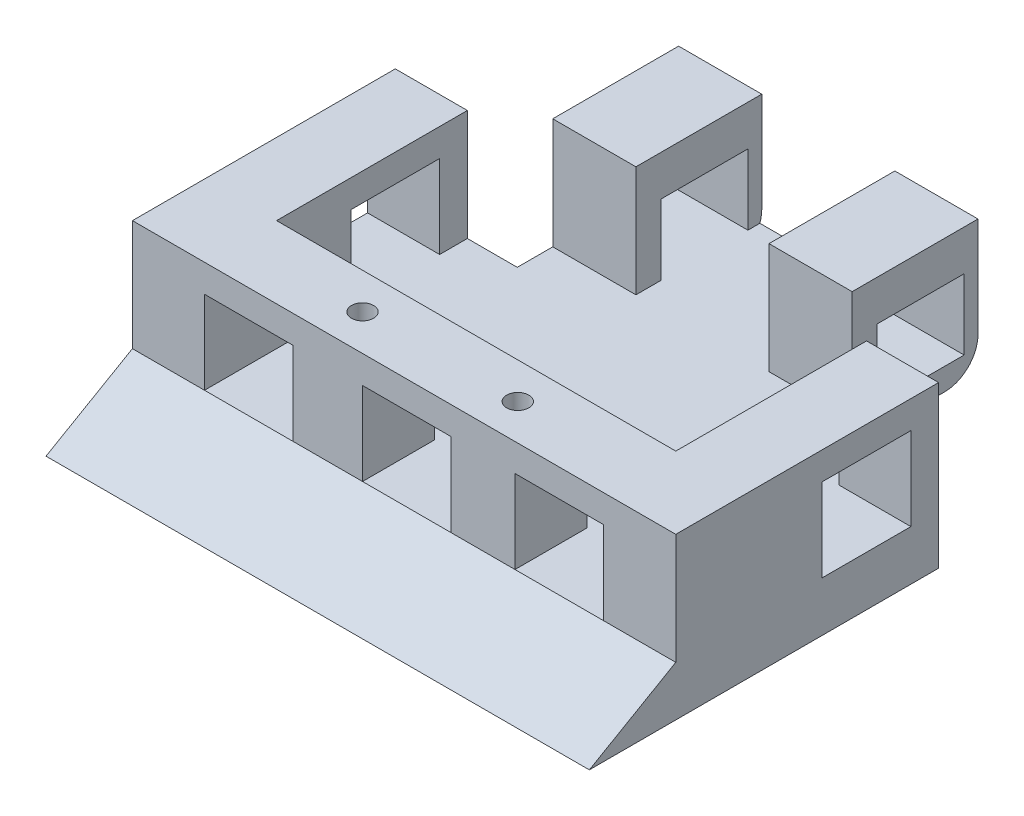
from build123d import *

# Parameters (mm, degrees)
CROQUIS1_W              = 98
CROQUIS1_H              = 98
SALIENTE_EXTRUIR1_DEPTH = 9
CHAFL_N1_SIZE2          = 15.588457268
CHAFL_N1_SIZE           = 9
CROQUIS2_W              = 22
CROQUIS2_H              = 35
CORTAR_EXTRUIR1_DEPTH   = 9
CROQUIS3_W              = 15
CROQUIS3_H              = 2.5
SALIENTE_EXTRUIR2_DEPTH = 12.2
CROQUIS4_W              = 15
CROQUIS4_H              = 20.2
SALIENTE_EXTRUIR3_DEPTH = 2.5
CROQUIS5_W              = 5.9
CROQUIS5_H              = 9
CORTAR_EXTRUIR2_DEPTH   = 54.2
CROQUIS6_W              = 15
CROQUIS6_H              = 14.7
SALIENTE_EXTRUIR4_DEPTH = 2.5
SALIENTE_EXTRUIR5_DEPTH = 20
CROQUIS8_W              = 16
CROQUIS8_H              = 15
CORTAR_EXTRUIR3_DEPTH   = 98
CROQUIS9_W              = 16
CROQUIS9_H              = 15
CORTAR_EXTRUIR4_DEPTH   = 13
CROQUIS10_W             = 15
CROQUIS10_H             = 22.7
SALIENTE_EXTRUIR6_DEPTH = 5.3
CROQUIS11_R             = 2
CORTAR_EXTRUIR5_DEPTH   = 10
CROQUIS12_W             = 29.1
CROQUIS12_H             = 5
CORTAR_EXTRUIR6_DEPTH   = 95.963150748
NERVIO1_REACH           = 77.12
CROQUIS13_WALL_W        = 159.310876118
CROQUIS13_WALL_H        = 54
REDONDEO1_R             = 6
CROQUIS14_W             = 15.7
CROQUIS14_H             = 12.7
CORTAR_EXTRUIR7_DEPTH   = 95.963150748


# Some blends are built 0.0001 mm under size
with BuildPart() as part:
    # Croquis1 → Saliente-Extruir1 (new body)
    with BuildSketch(Plane(origin=(0, 0, 0), x_dir=(1, 0, 0), z_dir=(0, 1, 0))):
        Rectangle(CROQUIS1_W, CROQUIS1_H)
    extrude(amount=SALIENTE_EXTRUIR1_DEPTH)

    # Chaflán1
    chafl_n1_edges = [part.edges().sort_by_distance(p)[0] for p in [
        (0, 9, 49),
    ]]
    chafl_n1_side = [part.faces().sort_by_distance(p)[0] for p in [
        (0, 8.82, 49),
    ]]
    chamfer(chafl_n1_edges, length=CHAFL_N1_SIZE - 0.0001, length2=CHAFL_N1_SIZE2 - 0.0001, reference=chafl_n1_side[0])  # a hair under: the kernel refuses the full size

    # Croquis2 → Cortar-Extruir1 (cut)
    with BuildSketch(Plane(origin=(0, 9, 0), x_dir=(1, 0, 0), z_dir=(0, 1, 0))):
        with Locations((-38, 31.5)):
            Rectangle(CROQUIS2_W, CROQUIS2_H)
        with Locations((38, 31.5)):
            Rectangle(CROQUIS2_W, CROQUIS2_H)
    extrude(amount=-CORTAR_EXTRUIR1_DEPTH, mode=Mode.SUBTRACT)

    # Croquis3 → Saliente-Extruir2 (add)
    with BuildSketch(Plane(origin=(0, 9, 0), x_dir=(1, 0, 0), z_dir=(0, 1, 0))):
        with Locations((19.5, 41.85)):
            Rectangle(CROQUIS3_W, CROQUIS3_H)
        with Locations((19.5, 24.15)):
            Rectangle(CROQUIS3_W, CROQUIS3_H)
        with Locations((-19.5, 41.85)):
            Rectangle(CROQUIS3_W, CROQUIS3_H)
        with Locations((-19.5, 24.15)):
            Rectangle(CROQUIS3_W, CROQUIS3_H)
    extrude(amount=SALIENTE_EXTRUIR2_DEPTH)

    # Croquis4 → Saliente-Extruir3 (add)
    with BuildSketch(Plane(origin=(0, 21.2, 0), x_dir=(1, 0, 0), z_dir=(0, 1, 0))):
        with Locations((-19.5, 33)):
            Rectangle(CROQUIS4_W, CROQUIS4_H)
        with Locations((19.5, 33)):
            Rectangle(CROQUIS4_W, CROQUIS4_H)
    extrude(amount=SALIENTE_EXTRUIR3_DEPTH)

    # Croquis5 → Cortar-Extruir2 (cut)
    with BuildSketch(Plane(origin=(27, 0, 0), x_dir=(0, 0, -1), z_dir=(1, 0, 0))):
        with Locations((46.05, 4.5)):
            Rectangle(CROQUIS5_W, CROQUIS5_H)
    extrude(amount=-CORTAR_EXTRUIR2_DEPTH, mode=Mode.SUBTRACT)

    # Croquis6 → Saliente-Extruir4 (add)
    with BuildSketch(Plane.XY.offset(-22.9)):
        with Locations((-19.5, 16.35)):
            Rectangle(CROQUIS6_W, CROQUIS6_H)
        with Locations((19.5, 16.35)):
            Rectangle(CROQUIS6_W, CROQUIS6_H)
    extrude(amount=SALIENTE_EXTRUIR4_DEPTH)

    # Croquis7 → Saliente-Extruir5 (add)
    with BuildSketch(Plane(origin=(0, 9, 0), x_dir=(1, 0, 0), z_dir=(0, 1, 0))):
        Polygon((-49, 14), (-49, -33.411542732), (49, -33.411542732), (49, 14), (36, 14), (36, -20.411542732), (-36, -20.411542732), (-36, 14), align=None)
    extrude(amount=SALIENTE_EXTRUIR5_DEPTH)

    # Croquis8 → Cortar-Extruir3 (cut)
    with BuildSketch(Plane(origin=(49, 0, 0), x_dir=(0, 0, -1), z_dir=(1, 0, 0))):
        with Locations((1, 16.5)):
            Rectangle(CROQUIS8_W, CROQUIS8_H)
    extrude(amount=-CORTAR_EXTRUIR3_DEPTH, mode=Mode.SUBTRACT)

    # Croquis9 → Cortar-Extruir4 (cut)
    with BuildSketch(Plane.XY.offset(33.411542732)):
        with Locations((-28, 16.5)):
            Rectangle(CROQUIS9_W, CROQUIS9_H)
        with Locations((0.5, 16.5)):
            Rectangle(CROQUIS9_W, CROQUIS9_H)
        with Locations((28, 16.5)):
            Rectangle(CROQUIS9_W, CROQUIS9_H)
    extrude(amount=-CORTAR_EXTRUIR4_DEPTH, mode=Mode.SUBTRACT)

    # Croquis10 → Saliente-Extruir6 (add)
    with BuildSketch(Plane(origin=(0, 23.7, 0), x_dir=(1, 0, 0), z_dir=(0, 1, 0))):
        with Locations((-19.5, 31.75)):
            Rectangle(CROQUIS10_W, CROQUIS10_H)
        with Locations((19.5, 31.75)):
            Rectangle(CROQUIS10_W, CROQUIS10_H)
    extrude(amount=SALIENTE_EXTRUIR6_DEPTH)

    # Croquis11 → Cortar-Extruir5 (cut)
    with BuildSketch(Plane(origin=(0, 29, 0), x_dir=(1, 0, 0), z_dir=(0, 1, 0))):
        with Locations(Location((-14, -26.911542732, 0), (0, 0, 270))):
            Circle(CROQUIS11_R)
        with Locations(Location((14, -26.911542732, 0), (0, 0, 270))):
            Circle(CROQUIS11_R)
    extrude(amount=-CORTAR_EXTRUIR5_DEPTH, mode=Mode.SUBTRACT)

    # Croquis12 → Cortar-Extruir6 (cut, through all)
    with BuildSketch(Plane(origin=(27, 0, 0), x_dir=(0, 0, -1), z_dir=(1, 0, 0))):
        with Locations((28.55, 2.5)):
            Rectangle(CROQUIS12_W, CROQUIS12_H)
    extrude(amount=-CORTAR_EXTRUIR6_DEPTH, mode=Mode.SUBTRACT)

    # Croquis13 wall → Nervio1 (add, up to next)
    with BuildSketch(Plane(origin=(0, 2.5, -16.5), x_dir=(0, -0.707106781187, 0.707106781187), z_dir=(0, -0.707106781187, -0.707106781187)), mode=Mode.PRIVATE) as nervio1_sk1:
        Rectangle(CROQUIS13_WALL_W, CROQUIS13_WALL_H)
    nervio1_tool1 = extrude(nervio1_sk1.sketch, amount=-NERVIO1_REACH, mode=Mode.PRIVATE) - part.part
    add(nervio1_tool1.solids().sort_by_distance((0, 2.5, -16.5))[0])

    # Redondeo1
    # the kernel refuses this fillet: 6 mm, written as the material it takes off along each edge
    with BuildSketch(Plane(origin=(42, 5, -43.1), x_dir=(0, 0, 1), z_dir=(-1, 0, 0))) as redondeo1_piece_1:
        with BuildLine():
            CenterArc((REDONDEO1_R, REDONDEO1_R), REDONDEO1_R, 180, 90)
            Line((0, REDONDEO1_R), (0, 0))
            Line((0, 0), (REDONDEO1_R, 0))
        make_face()
    extrude(amount=84, mode=Mode.SUBTRACT)

    # Croquis14 → Cortar-Extruir7 (cut, through all)
    with BuildSketch(Plane(origin=(27, 0, 0), x_dir=(0, 0, -1), z_dir=(1, 0, 0))):
        with Locations((32.75, 15.35)):
            Rectangle(CROQUIS14_W, CROQUIS14_H)
    extrude(amount=-CORTAR_EXTRUIR7_DEPTH, mode=Mode.SUBTRACT)


solid = part.part
